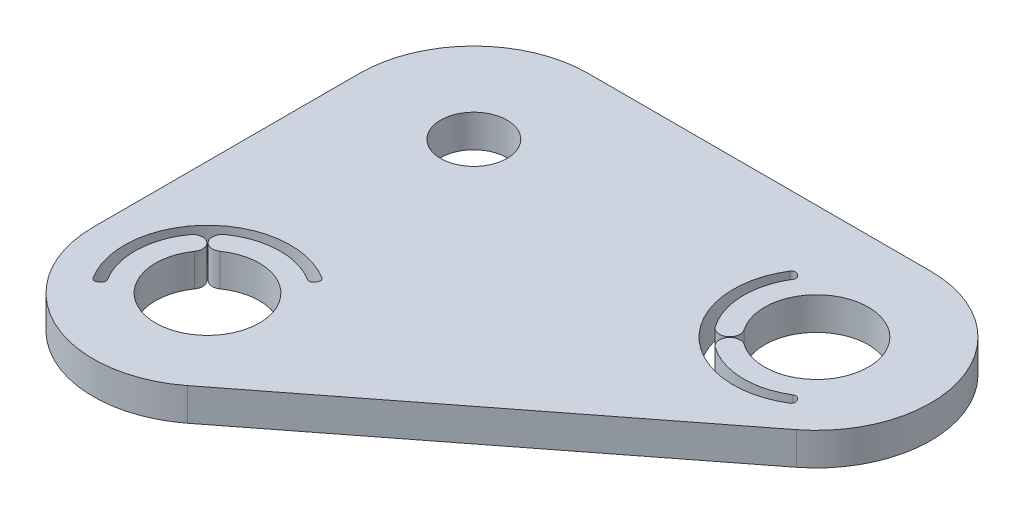
from build123d import *

# Parameters (mm, degrees)
SKETCH2_R           = 1.6
SKETCH2_R_2         = 2.5
BOSS_EXTRUDE1_DEPTH = 1.57
BORE_RELIEF_DEPTH   = 29.675259807


with BuildPart() as part:
    # Sketch2 → Boss-Extrude1 (new body)
    with BuildSketch(Plane(origin=(0, 0, 0), x_dir=(1, 0, 0), z_dir=(0, 1, 0))):
        with BuildLine():
            Line((-5.5, 0), (-5.5, 12.825))
            ThreePointArc((-5.5, 12.825), (-3.889087297, 16.714087297), (0, 18.325))
            Line((0, 18.325), (16.5, 18.325))
            ThreePointArc((16.5, 18.325), (21.702583448, 14.609131572), (19.875306686, 8.48250017))
            Line((19.875306686, 8.48250017), (3.375306686, -4.34249983))
            ThreePointArc((3.375306686, -4.34249983), (-2.417210502, -4.940353569), (-5.5, 0))
        make_face()
        with Locations((0, 12.825)):
            Circle(SKETCH2_R, mode=Mode.SUBTRACT)
        with Locations((16.5, 12.825)):
            Circle(SKETCH2_R_2, mode=Mode.SUBTRACT)
        Circle(SKETCH2_R_2, mode=Mode.SUBTRACT)
    extrude(amount=BOSS_EXTRUDE1_DEPTH)

    # Sketch5 → bore relief (cut, through all)
    with BuildSketch(Plane.XZ):
        with BuildLine():
            Line((13.473568524, -14.944130133), (13.391536548, -15.001569541))
            ThreePointArc((13.391536548, -15.001569541), (13.236918666, -15.033718169), (13.107180275, -14.943672771))
            ThreePointArc((13.107180275, -14.943672771), (13.671572875, -9.996572875), (18.618672771, -9.432180275))
            ThreePointArc((18.618672771, -9.432180275), (18.708718169, -9.561918666), (18.676569541, -9.716536548))
            Line((18.676569541, -9.716536548), (18.619130133, -9.798568524))
            ThreePointArc((18.619130133, -9.798568524), (18.495341896, -9.879803803), (18.349607847, -9.853644954))
            ThreePointArc((18.349607847, -9.853644954), (16.405370812, -9.326279474), (14.492482473, -9.957967845))
            ThreePointArc((14.492482473, -9.957967845), (14.369694669, -10.654332085), (15.066058909, -10.777119889))
            ThreePointArc((15.066058909, -10.777119889), (14.732233047, -11.057233047), (14.452119889, -11.391058909))
            ThreePointArc((14.452119889, -11.391058909), (14.329332085, -10.694694669), (13.632967845, -10.817482473))
            ThreePointArc((13.632967845, -10.817482473), (13.001279474, -12.730370812), (13.528644954, -14.674607847))
            ThreePointArc((13.528644954, -14.674607847), (13.554803803, -14.820341896), (13.473568524, -14.944130133))
        make_face()
        with BuildLine():
            Line((2.119130133, -3.026431476), (2.176569541, -3.108463452))
            ThreePointArc((2.176569541, -3.108463452), (2.208718169, -3.263081334), (2.118672771, -3.392819725))
            ThreePointArc((2.118672771, -3.392819725), (-2.828427125, -2.828427125), (-3.392819725, 2.118672771))
            ThreePointArc((-3.392819725, 2.118672771), (-3.263081334, 2.208718169), (-3.108463452, 2.176569541))
            Line((-3.108463452, 2.176569541), (-3.026431476, 2.119130133))
            ThreePointArc((-3.026431476, 2.119130133), (-2.945196197, 1.995341896), (-2.971355046, 1.849607847))
            ThreePointArc((-2.971355046, 1.849607847), (-3.498720526, -0.094629188), (-2.867032155, -2.007517527))
            ThreePointArc((-2.867032155, -2.007517527), (-2.170667915, -2.130305331), (-2.047880111, -1.433941091))
            ThreePointArc((-2.047880111, -1.433941091), (-1.767766953, -1.767766953), (-1.433941091, -2.047880111))
            ThreePointArc((-1.433941091, -2.047880111), (-2.130305331, -2.170667915), (-2.007517527, -2.867032155))
            ThreePointArc((-2.007517527, -2.867032155), (-0.094629188, -3.498720526), (1.849607847, -2.971355046))
            ThreePointArc((1.849607847, -2.971355046), (1.995341896, -2.945196197), (2.119130133, -3.026431476))
        make_face()
    extrude(amount=-BORE_RELIEF_DEPTH, mode=Mode.SUBTRACT)


solid = part.part
